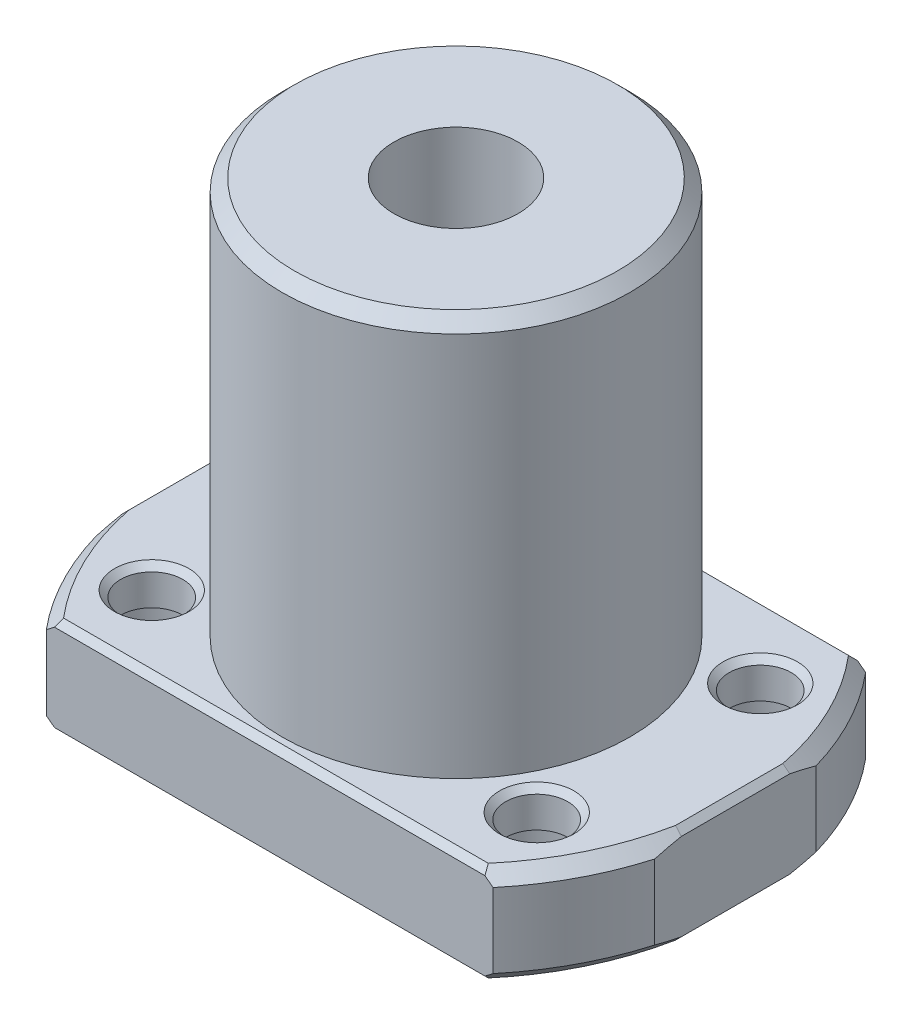
from build123d import *
from build123d.topology import SkipClean

# Parameters (mm, degrees)
SKETCH1_R           = 14
SKETCH1_R_2         = 5
BOSS_EXTRUDE1_DEPTH = 32
BOSS_EXTRUDE3_START = 8
SKETCH2_R           = 2.5
SKETCH2_R_2         = 5
BOSS_EXTRUDE3_DEPTH = 8
SKETCH3_R           = 4
CUT_EXTRUDE1_DEPTH  = 5
CHAMFER2_SIZE       = 0.5
CHAMFER3_SIZE       = 1
CHAMFER4_SIZE       = 0.5


with BuildPart() as part:
    # Sketch1 → Boss-Extrude1 (new body)
    with BuildSketch(Plane(origin=(0, 0, 0), x_dir=(1, 0, 0), z_dir=(0, 1, 0))):
        with Locations(Location((0, 0, 0), (0, 0, 270))):
            Circle(SKETCH1_R)
        with Locations(Location((0, 0, 0), (0, 0, 270))):
            Circle(SKETCH1_R_2, mode=Mode.SUBTRACT)
    extrude(amount=BOSS_EXTRUDE1_DEPTH)

    # Sketch2 → Boss-Extrude3 (add)
    with SkipClean():  # the faces are left unmerged after this step: merging them gives an invalid solid
        with BuildSketch(Plane.XZ.offset(BOSS_EXTRUDE3_START)):
            with BuildLine():
                ThreePointArc((-22.5, -6.5), (-20.684382748, -10.984366633), (-17.986105749, -15))
                Line((-17.986105749, -15), (17.986105749, -15))
                ThreePointArc((17.986105749, -15), (20.684382748, -10.984366633), (22.5, -6.5))
                Line((22.5, -6.5), (22.5, 6.5))
                ThreePointArc((22.5, 6.5), (20.684382748, 10.984366633), (17.986105749, 15))
                Line((17.986105749, 15), (-17.986105749, 15))
                ThreePointArc((-17.986105749, 15), (-20.684382748, 10.984366633), (-22.5, 6.5))
                Line((-22.5, 6.5), (-22.5, -6.5))
            make_face()
            with Locations(Location((-15.5, -9, 0), (0, 0, 270))):
                Circle(SKETCH2_R, mode=Mode.SUBTRACT)
            with Locations(Location((0, 0, 0), (0, 0, 270))):
                Circle(SKETCH2_R_2, mode=Mode.SUBTRACT)
            with Locations(Location((15.5, -9, 0), (0, 0, 270))):
                Circle(SKETCH2_R, mode=Mode.SUBTRACT)
            with Locations(Location((-15.5, 9, 0), (0, 0, 270))):
                Circle(SKETCH2_R, mode=Mode.SUBTRACT)
            with Locations(Location((15.5, 9, 0), (0, 0, 270))):
                Circle(SKETCH2_R, mode=Mode.SUBTRACT)
        extrude(amount=-BOSS_EXTRUDE3_DEPTH)

    # Sketch3 → Cut-Extrude1 (cut)
    with SkipClean():  # the faces are left unmerged after this step: merging them gives an invalid solid
        with BuildSketch(Plane.XZ.offset(8)):
            with Locations(Location((-15.5, 9, 0), (0, 0, 270))):
                Circle(SKETCH3_R)
            with Locations(Location((-15.5, -9, 0), (0, 0, 270))):
                Circle(SKETCH3_R)
            with Locations(Location((15.5, -9, 0), (0, 0, 270))):
                Circle(SKETCH3_R)
            with Locations(Location((15.5, 9, 0), (0, 0, 270))):
                Circle(SKETCH3_R)
        extrude(amount=-CUT_EXTRUDE1_DEPTH, mode=Mode.SUBTRACT)

    # Chamfer2
    chamfer2_edges = [part.edges().sort_by_distance(p)[0] for p in [
        (22.5, 0, 0),
        (0, -8, 15),
        (-22.5, -8, 0),
        (0, -8, -15),
        (22.5, -8, 0),
        (-15.5, 0, -6.5),
        (15.5, 0, -6.5),
        (15.5, 0, 11.5),
        (-15.5, 0, 11.5),
        (-22.5, 0, 0),
        (0, 0, 15),
        (0, 0, -15),
    ]]
    chamfer(chamfer2_edges, length=CHAMFER2_SIZE)

    # Chamfer3
    chamfer3_edges = [part.edges().sort_by_distance(p)[0] for p in [
        (20.453146311, -8, -11.409154481),
        (-20.453146311, -8, -11.409154481),
        (-20.453146311, -8, 11.409154481),
        (20.453146311, -8, 11.409154481),
        (20.453146311, 0, -11.409154481),
        (20.453146311, 0, 11.409154481),
        (-20.453146311, 0, 11.409154481),
        (-20.453146311, 0, -11.409154481),
        (0, 32, -14),
    ]]
    chamfer(chamfer3_edges, length=CHAMFER3_SIZE)

    # Chamfer4
    # the kernel refuses this chamfer: 0.5 mm, written as the material it takes off along each edge
    with BuildSketch(Plane(origin=(15.5, -8, 9), x_dir=(0, 0, -1), z_dir=(-1, 0, 0))) as chamfer4_piece_1:
        Polygon((4 + CHAMFER4_SIZE, 0), (4, -CHAMFER4_SIZE), (4, 0), align=None)
    revolve(axis=Axis((15.5, -8, 9), (0, -1, 0)), mode=Mode.SUBTRACT)
    with BuildSketch(Plane(origin=(15.5, -8, -9), x_dir=(0, 0, -1), z_dir=(-1, 0, 0))) as chamfer4_piece_2:
        Polygon((4 + CHAMFER4_SIZE, 0), (4, -CHAMFER4_SIZE), (4, 0), align=None)
    revolve(axis=Axis((15.5, -8, -9), (0, -1, 0)), mode=Mode.SUBTRACT)
    with BuildSketch(Plane(origin=(-15.5, -8, -9), x_dir=(0, 0, -1), z_dir=(-1, 0, 0))) as chamfer4_piece_3:
        Polygon((4 + CHAMFER4_SIZE, 0), (4, -CHAMFER4_SIZE), (4, 0), align=None)
    revolve(axis=Axis((-15.5, -8, -9), (0, -1, 0)), mode=Mode.SUBTRACT)
    with BuildSketch(Plane(origin=(-15.5, -8, 9), x_dir=(0, 0, -1), z_dir=(-1, 0, 0))) as chamfer4_piece_4:
        Polygon((4 + CHAMFER4_SIZE, 0), (4, -CHAMFER4_SIZE), (4, 0), align=None)
    revolve(axis=Axis((-15.5, -8, 9), (0, -1, 0)), mode=Mode.SUBTRACT)


solid = part.part
